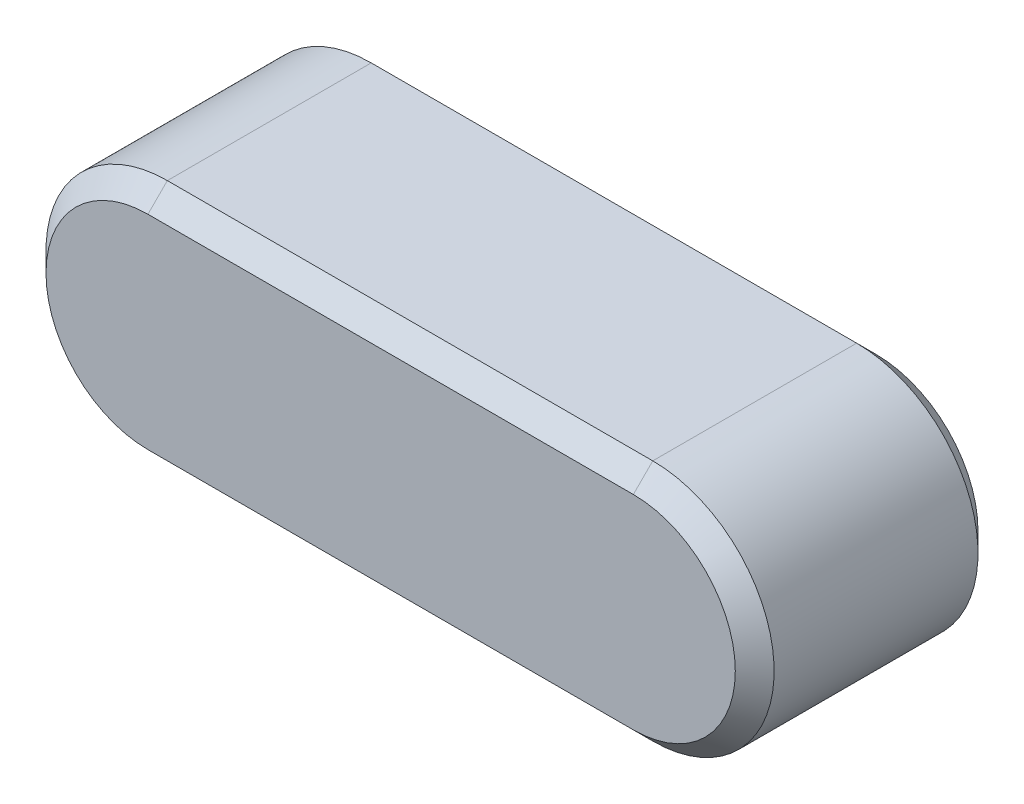
from build123d import *

# Parameters (mm, degrees)
EXTRUDE1_DEPTH = 2
CHAMFER1_SIZE  = 0.16


with BuildPart() as part:
    # Sketch1 → Extrude1 (new body)
    with BuildSketch(Plane.XY):
        with BuildLine():
            Line((0, 1), (-4, 1))
            ThreePointArc((-4, 1), (-5, 0), (-4, -1))
            Line((-4, -1), (0, -1))
            ThreePointArc((0, -1), (1, 0), (0, 1))
        make_face()
    extrude(amount=EXTRUDE1_DEPTH)

    # Chamfer1
    chamfer1_edges = [part.edges().sort_by_distance(p)[0] for p in [
        (-2, 1, 0),
        (-2, -1, 0),
        (-2, 1, 2),
        (-2, -1, 2),
        (-5, 0, 0),
        (-5, 0, 2),
        (1, 0, 0),
        (1, 0, 2),
    ]]
    chamfer(chamfer1_edges, length=CHAMFER1_SIZE)


solid = part.part
